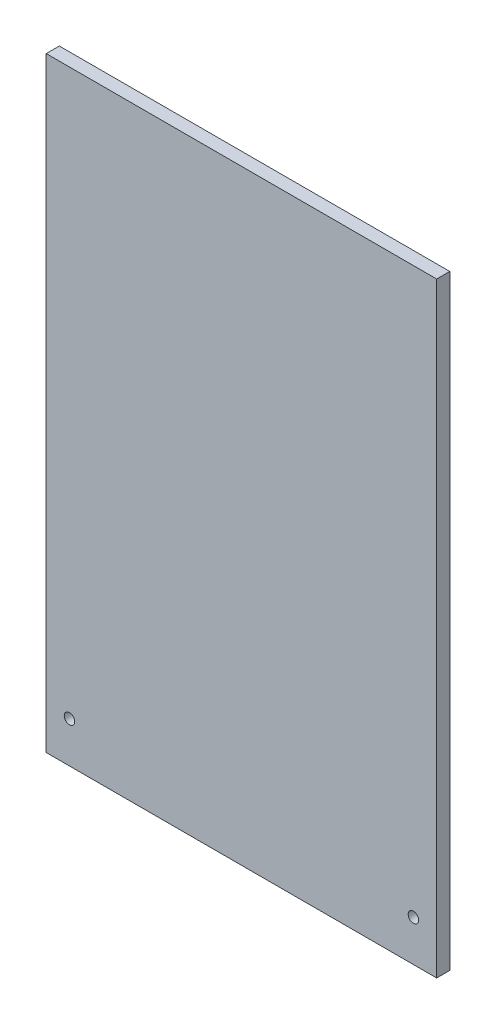
from build123d import *

# Parameters (mm, degrees)
SKETCH1_W      = 119.2
SKETCH1_H      = 184.8
SKETCH1_R      = 1.6
EXTRUDE1_DEPTH = 4


with BuildPart() as part:
    # Sketch1 → Extrude1 (new body)
    with BuildSketch(Plane.XY):
        with Locations((0, 92.4)):
            Rectangle(SKETCH1_W, SKETCH1_H)
        with Locations((52.5, 12.5)):
            Circle(SKETCH1_R, mode=Mode.SUBTRACT)
        with Locations((-52.5, 12.5)):
            Circle(SKETCH1_R, mode=Mode.SUBTRACT)
    extrude(amount=EXTRUDE1_DEPTH)


solid = part.part
